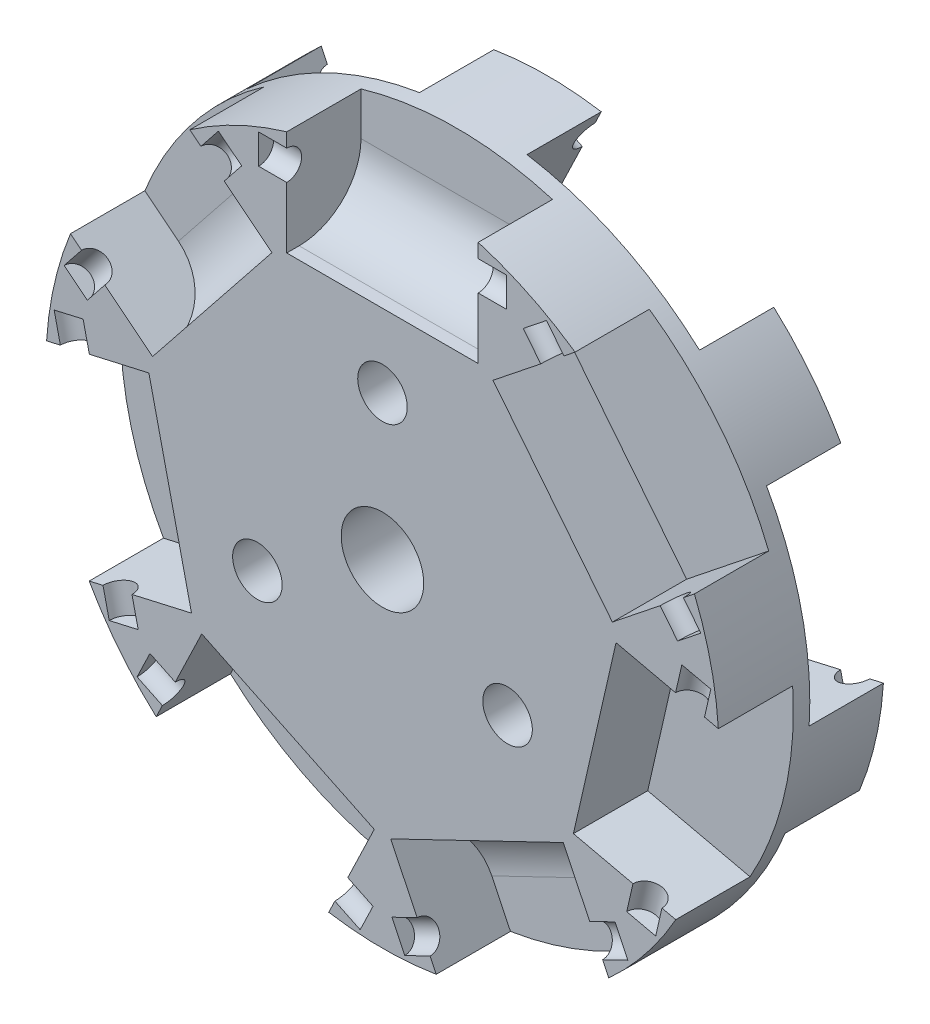
from build123d import *

# Parameters (mm, degrees)
SKETCH1_R           = 25.8953
BOSS_EXTRUDE2_DEPTH = 6.35
SKETCH2_W           = 14.732
SKETCH2_H           = 10.414
CUT_EXTRUDE2_DEPTH  = 5.715
CIRPATTERN1_COUNT   = 7
SKETCH4_R           = 1.143
CUT_EXTRUDE4_DEPTH  = 9.525
CIRPATTERN2_COUNT   = 7
SKETCH5_R           = 3.175
CUT_EXTRUDE5_DEPTH  = 38.167938121
SKETCH6_R           = 1.905
CUT_EXTRUDE7_DEPTH  = 38.167938121
BOSS_EXTRUDE3_START = 6.35
SKETCH9_R           = 25.8953
SKETCH9_R_2         = 1.905
SKETCH9_R_3         = 3.175
BOSS_EXTRUDE3_DEPTH = 6.35
CUT_EXTRUDE8_DEPTH  = 5.715
CIRPATTERN3_COUNT   = 7
SKETCH11_R          = 1.143
CUT_EXTRUDE9_DEPTH  = 9.525
CIRPATTERN4_COUNT   = 7
FILLET1_R           = 4.7625


with BuildPart() as part:
    # Sketch1 → Boss-Extrude2 (new body)
    with BuildSketch(Plane.XY):
        Circle(SKETCH1_R)
    extrude(amount=-BOSS_EXTRUDE2_DEPTH)

    # Sketch2 → Cut-Extrude2 (cut)
    with BuildSketch(Plane.XY):
        with Locations((0, 21.9583)):
            Rectangle(SKETCH2_W, SKETCH2_H)
    cut_extrude2 = extrude(amount=-CUT_EXTRUDE2_DEPTH, mode=Mode.SUBTRACT)

    # CirPattern1: Cut-Extrude2 ×7 about axis
    cirpattern1_axis = Axis((0, 0, 0), (0, 0, 1))
    for i in range(1, CIRPATTERN1_COUNT):
        add(cut_extrude2.rotate(cirpattern1_axis, i * 360 / CIRPATTERN1_COUNT), mode=Mode.SUBTRACT)

    # Sketch4 → Cut-Extrude4 (cut, symmetric)
    with BuildSketch(Plane(origin=(0, 0, 0), x_dir=(0, 0, -1), z_dir=(1, 0, 0))):
        with Locations((0, 22.5933)):
            Circle(SKETCH4_R)
    cut_extrude4 = extrude(amount=CUT_EXTRUDE4_DEPTH, both=True, mode=Mode.SUBTRACT)

    # CirPattern2: Cut-Extrude4 ×7 about axis
    cirpattern2_axis = Axis((0, 0, 0), (0, 0, 1))
    for i in range(1, CIRPATTERN2_COUNT):
        add(cut_extrude4.rotate(cirpattern2_axis, i * 360 / CIRPATTERN2_COUNT), mode=Mode.SUBTRACT)

    # Sketch5 → Cut-Extrude5 (cut, through all)
    with BuildSketch(Plane.XY):
        Circle(SKETCH5_R)
    extrude(amount=-CUT_EXTRUDE5_DEPTH, mode=Mode.SUBTRACT)

    # Sketch6 → Cut-Extrude7 (cut, through all)
    with BuildSketch(Plane(origin=(0, 0, -6.35), x_dir=(-1, 0, 0), z_dir=(0, 0, -1))):
        with Locations((0, 11.1125)):
            Circle(SKETCH6_R)
        with Locations((9.6237073, -5.55625)):
            Circle(SKETCH6_R)
        with Locations((-9.6237073, -5.55625)):
            Circle(SKETCH6_R)
    extrude(amount=-CUT_EXTRUDE7_DEPTH, mode=Mode.SUBTRACT)

    # Sketch9 → Boss-Extrude3 (add)
    with BuildSketch(Plane(origin=(0, 0, -6.35), x_dir=(-1, 0, 0), z_dir=(0, 0, -1)).offset(BOSS_EXTRUDE3_START)):
        Circle(SKETCH9_R)
        with Locations((9.6237073, -5.55625)):
            Circle(SKETCH9_R_2, mode=Mode.SUBTRACT)
        Circle(SKETCH9_R_3, mode=Mode.SUBTRACT)
        with Locations((-9.6237073, -5.55625)):
            Circle(SKETCH9_R_2, mode=Mode.SUBTRACT)
        with Locations((0, 11.1125)):
            Circle(SKETCH9_R_2, mode=Mode.SUBTRACT)
    extrude(amount=-BOSS_EXTRUDE3_DEPTH)

    # Sketch10 → Cut-Extrude8 (cut)
    with BuildSketch(Plane(origin=(0, 0, -12.7), x_dir=(-1, 0, 0), z_dir=(0, 0, -1))):
        Polygon((-0.631579998, 18.288387419), (-13.90465336, 11.896412175), (-18.423118619, 21.279101965), (-5.150045257, 27.67107721), align=None)
    cut_extrude8 = extrude(amount=-CUT_EXTRUDE8_DEPTH, mode=Mode.SUBTRACT)

    # CirPattern3: Cut-Extrude8 ×7 about axis
    cirpattern3_axis = Axis((0, 0, -12.7), (0, 0, -1))
    for i in range(1, CIRPATTERN3_COUNT):
        add(cut_extrude8.rotate(cirpattern3_axis, i * 360 / CIRPATTERN3_COUNT), mode=Mode.SUBTRACT)

    # Sketch11 → Cut-Extrude9 (cut, symmetric)
    with BuildSketch(Plane(origin=(0, 0, 0), x_dir=(0, 0, -1), z_dir=(-0.9009688679024186, 0.43388373911755934, 0))):
        with Locations((12.7, -22.5933)):
            Circle(SKETCH11_R)
    cut_extrude9 = extrude(amount=CUT_EXTRUDE9_DEPTH, both=True, mode=Mode.SUBTRACT)

    # CirPattern4: Cut-Extrude9 ×7 about axis
    cirpattern4_axis = Axis((0, 0, -12.7), (0, 0, -1))
    for i in range(1, CIRPATTERN4_COUNT):
        add(cut_extrude9.rotate(cirpattern4_axis, i * 360 / CIRPATTERN4_COUNT), mode=Mode.SUBTRACT)

    # Fillet1
    fillet1_edges = [part.edges().sort_by_distance(p)[0] for p in [
        (16.331309935, 3.727514921, -6.985),
        (13.096693712, -10.444264718, -6.985),
        (0, -16.7513, -6.985),
        (7.268116679, 15.092399797, -6.985),
        (-13.096693712, -10.444264718, -6.985),
        (-16.331309935, -3.727514921, -5.715),
        (-7.268116679, -15.092399797, -5.715),
        (7.268116679, -15.092399797, -5.715),
        (0, 16.7513, -5.715),
        (-13.096693712, 10.444264718, -5.715),
    ]]
    fillet(fillet1_edges, radius=FILLET1_R)


solid = part.part
